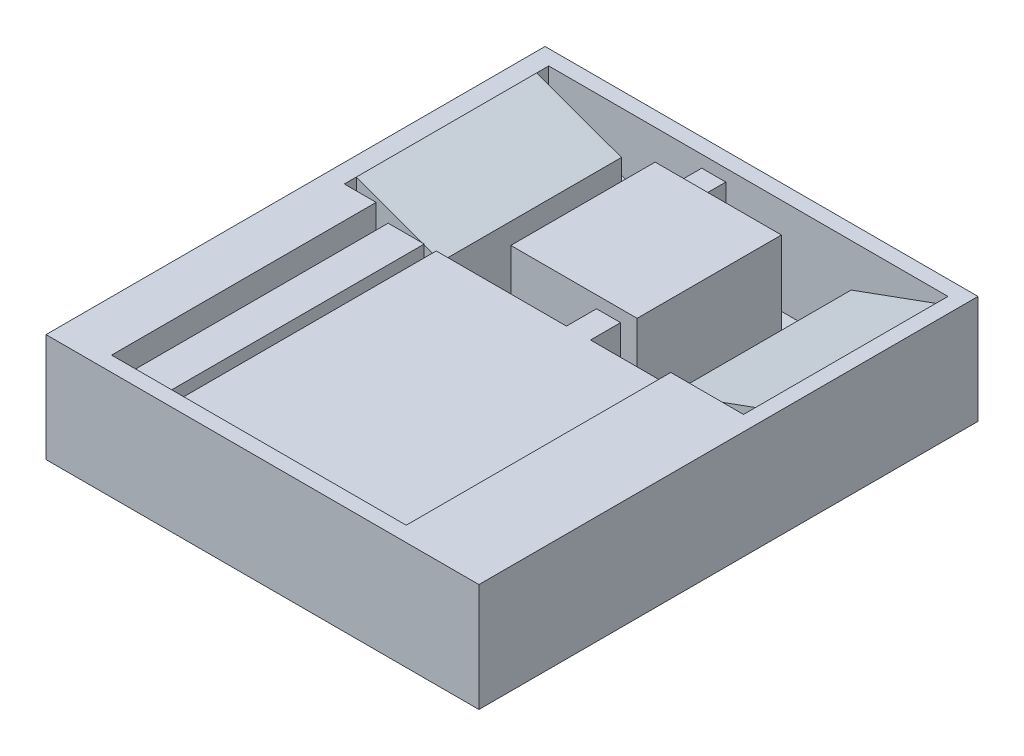
from build123d import *

# Parameters (mm, degrees)
SKETCH1_W           = 72
SKETCH1_H           = 83
BOSS_EXTRUDE1_DEPTH = 18
CAVITY2_START       = -80.5
CAVITY2_DEPTH       = 34
CAVITY2_START_2     = -48.5
CAVITY2_2_DEPTH     = 46
CAVITY2_3_DEPTH     = 5
CAVITY2_START_3     = -51.5
CAVITY2_4_DEPTH     = 5
CAVITY2_START_4     = -4.5
CAVITY2_5_OUTLINE_W = 37
CAVITY2_5_OUTLINE_H = 5
CAVITY2_5_DEPTH     = 2
CAVITY2_6_DEPTH     = 2
CAVITY2_7_DEPTH     = 2


# Read off the part's stored shape, not the designer's step: Cavity2
with BuildPart() as part:
    # Sketch1 → Boss-Extrude1 (new body)
    with BuildSketch(Plane(origin=(0, 0, 0), x_dir=(1, 0, 0), z_dir=(0, 1, 0))):
        with Locations((36, 41.5)):
            Rectangle(SKETCH1_W, SKETCH1_H)
    extrude(amount=BOSS_EXTRUDE1_DEPTH)

    # Cavity2 outline → Cavity2 (cut)
    with BuildSketch(Plane.XY.offset(CAVITY2_START)):
        Polygon((55.404610688, 2), (55.404610688, 12.86969785), (69.5, 18), (46.804610688, 18), (46.804610688, 2), align=None)
        Polygon((25.804610688, 18), (3.109221376, 18), (17.204610688, 12.86969785), (17.204610688, 2), (25.804610688, 2), align=None)
    extrude(amount=CAVITY2_DEPTH, mode=Mode.SUBTRACT)

    # Cavity2 2 outline → Cavity2 2 (cut)
    with BuildSketch(Plane.XY.offset(CAVITY2_START_2)):
        Polygon((55.404610688, 11), (57.404610688, 11), (57.404610688, 18), (8.404610688, 18), (8.404610688, 11), (10.404610688, 11), (10.404610688, 16), (16.404610688, 16), (16.404610688, 11), (18.404610688, 11), (18.404610688, 16), (55.404610688, 16), align=None)
    extrude(amount=CAVITY2_2_DEPTH, mode=Mode.SUBTRACT)

    # Cavity2 3 outline → Cavity2 3 (cut)
    with BuildSketch(Plane.XY.offset(CAVITY2_START)):
        Polygon((46.804610688, 2), (46.804610688, 18), (25.804610688, 18), (25.804610688, 2), (28.554610688, 2), (28.554610688, 16), (32.554610688, 16), (32.554610688, 2), align=None)
    extrude(amount=CAVITY2_3_DEPTH, mode=Mode.SUBTRACT)

    # Cavity2 4 outline → Cavity2 4 (cut)
    with BuildSketch(Plane.XY.offset(CAVITY2_START_3)):
        Polygon((46.804610688, 2), (46.804610688, 18), (25.804610688, 18), (25.804610688, 2), (40.054610688, 2), (40.054610688, 16), (44.054610688, 16), (44.054610688, 2), align=None)
    extrude(amount=CAVITY2_4_DEPTH, mode=Mode.SUBTRACT)

    # Cavity2 5 outline → Cavity2 5 (cut)
    with BuildSketch(Plane.XY.offset(CAVITY2_START_4)):
        with Locations((36.904610688, 13.5)):
            Rectangle(CAVITY2_5_OUTLINE_W, CAVITY2_5_OUTLINE_H)
    extrude(amount=CAVITY2_5_DEPTH, mode=Mode.SUBTRACT)

    # Cavity2 6 outline → Cavity2 6 (cut)
    with BuildSketch(Plane.XY.offset(CAVITY2_START)):
        Polygon((55.404610688, 7.548808988), (69.5, 12.679111138), (69.5, 18), (55.404610688, 12.86969785), align=None)
        Polygon((3.109221376, 18), (3.109221376, 12.679111138), (17.204610688, 7.548808988), (17.204610688, 12.86969785), align=None)
    extrude(amount=CAVITY2_6_DEPTH, mode=Mode.SUBTRACT)

    # Cavity2 7 outline → Cavity2 7 (cut)
    with BuildSketch(Plane.XY.offset(CAVITY2_START_2)):
        Polygon((55.404610688, 7.548808988), (69.5, 12.679111138), (69.5, 18), (57.404610688, 13.597638319), (57.404610688, 11), (55.404610688, 11), align=None)
        Polygon((8.404610688, 11), (8.404610688, 16.072635912), (3.109221376, 18), (3.109221376, 12.679111138), (17.204610688, 7.548808988), (17.204610688, 11), (16.404610688, 11), (16.404610688, 13.160874037), (10.404610688, 15.344695443), (10.404610688, 11), align=None)
    extrude(amount=CAVITY2_7_DEPTH, mode=Mode.SUBTRACT)


solid = part.part
